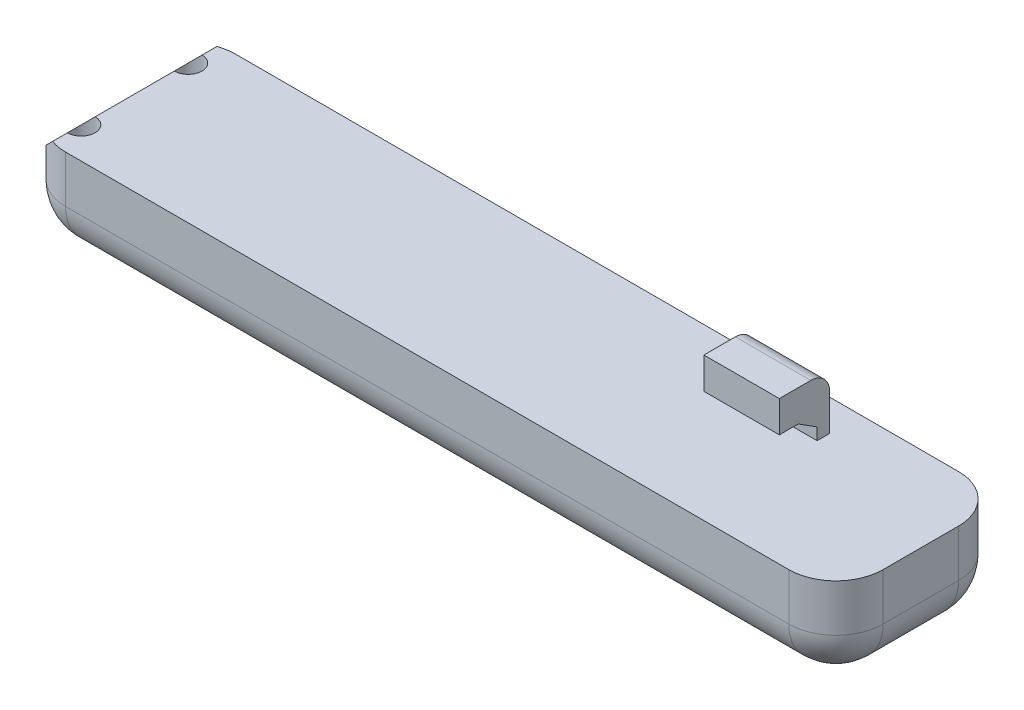
from build123d import *

# Parameters (mm, degrees)
BOSS_EXTRUDE1_DEPTH = 15
FILLET1_R           = 7.5
CHAMFER1_SIZE       = 5
SKETCH2_R           = 2.2
CUT_EXTRUDE1_DEPTH  = 10
SKETCH3_W           = 12
SKETCH3_H           = 2
BOSS_EXTRUDE2_DEPTH = 3.8
SKETCH4_W           = 12
SKETCH4_H           = 8
BOSS_EXTRUDE3_DEPTH = 5
FILLET2_R           = 3
BOSS_EXTRUDE4_DEPTH = 12


with BuildPart() as part:
    # Sketch1 → Boss-Extrude1 (new body)
    with BuildSketch(Plane(origin=(0, 0, 0), x_dir=(1, 0, 0), z_dir=(0, 1, 0))):
        with BuildLine():
            Line((7.5, 27), (122.5, 27))
            ThreePointArc((122.5, 27), (127.803300859, 24.803300859), (130, 19.5))
            Line((130, 19.5), (130, 7.5))
            ThreePointArc((130, 7.5), (127.803300859, 2.196699141), (122.5, 0))
            Line((122.5, 0), (7.5, 0))
            ThreePointArc((7.5, 0), (2.196699141, 2.196699141), (0, 7.5))
            Line((0, 7.5), (0, 19.5))
            ThreePointArc((0, 19.5), (2.196699141, 24.803300859), (7.5, 27))
        make_face()
    extrude(amount=BOSS_EXTRUDE1_DEPTH)

    # Fillet1
    fillet1_edges = [part.edges().sort_by_distance(p)[0] for p in [
        (0, 0, -13.5),
        (2.196699141, 0, -24.803300859),
        (65, 0, -27),
        (127.803300859, 0, -24.803300859),
        (130, 0, -13.5),
        (127.803300859, 0, -2.196699141),
        (65, 0, 0),
        (2.196699141, 0, -2.196699141),
    ]]
    fillet(fillet1_edges, radius=FILLET1_R)

    # Chamfer1
    # the kernel refuses this chamfer: 5 mm, written as the material it takes off along each edge
    with BuildSketch(Plane(origin=(0, 15, 5.35841494), x_dir=(-0.02749587661058638, -0.9996219169112968, 0), z_dir=(0, 0, -1))) as chamfer1_piece_1:
        Polygon((CHAMFER1_SIZE * 0.999621916911, -CHAMFER1_SIZE * 0.0274958766106), (-CHAMFER1_SIZE * 0.0274958766106, -CHAMFER1_SIZE * 0.999621916911), (0, 0), align=None)
    extrude(amount=37.71682988, mode=Mode.SUBTRACT)

    # Sketch2 → Cut-Extrude1 (cut)
    with BuildSketch(Plane(origin=(0, 15, 0), x_dir=(1, 0, 0), z_dir=(0, 1, 0))):
        with Locations(Location((5, 22, 0), (0, 0, 270))):
            Circle(SKETCH2_R)
        with Locations(Location((5, 5, 0), (0, 0, 270))):
            Circle(SKETCH2_R)
    extrude(amount=-CUT_EXTRUDE1_DEPTH, mode=Mode.SUBTRACT)

    # Sketch3 → Boss-Extrude2 (add)
    with BuildSketch(Plane(origin=(0, 15, 0), x_dir=(1, 0, 0), z_dir=(0, 1, 0))):
        with Locations((101, 21)):
            Rectangle(SKETCH3_W, SKETCH3_H)
    extrude(amount=BOSS_EXTRUDE2_DEPTH)

    # Sketch4 → Boss-Extrude3 (add)
    with BuildSketch(Plane(origin=(0, 18.8, 0), x_dir=(1, 0, 0), z_dir=(0, 1, 0))):
        with Locations((101, 18)):
            Rectangle(SKETCH4_W, SKETCH4_H)
    extrude(amount=BOSS_EXTRUDE3_DEPTH)

    # Fillet2
    fillet2_edges = [part.edges().sort_by_distance(p)[0] for p in [
        (101, 23.8, -22),
    ]]
    fillet(fillet2_edges, radius=FILLET2_R)

    # Sketch5 → Boss-Extrude4 (add)
    with BuildSketch(Plane.ZY.offset(-95)):
        Polygon((-20, 18.8), (-17, 18.8), (-20, 16.9), align=None)
    extrude(amount=-BOSS_EXTRUDE4_DEPTH)


solid = part.part
